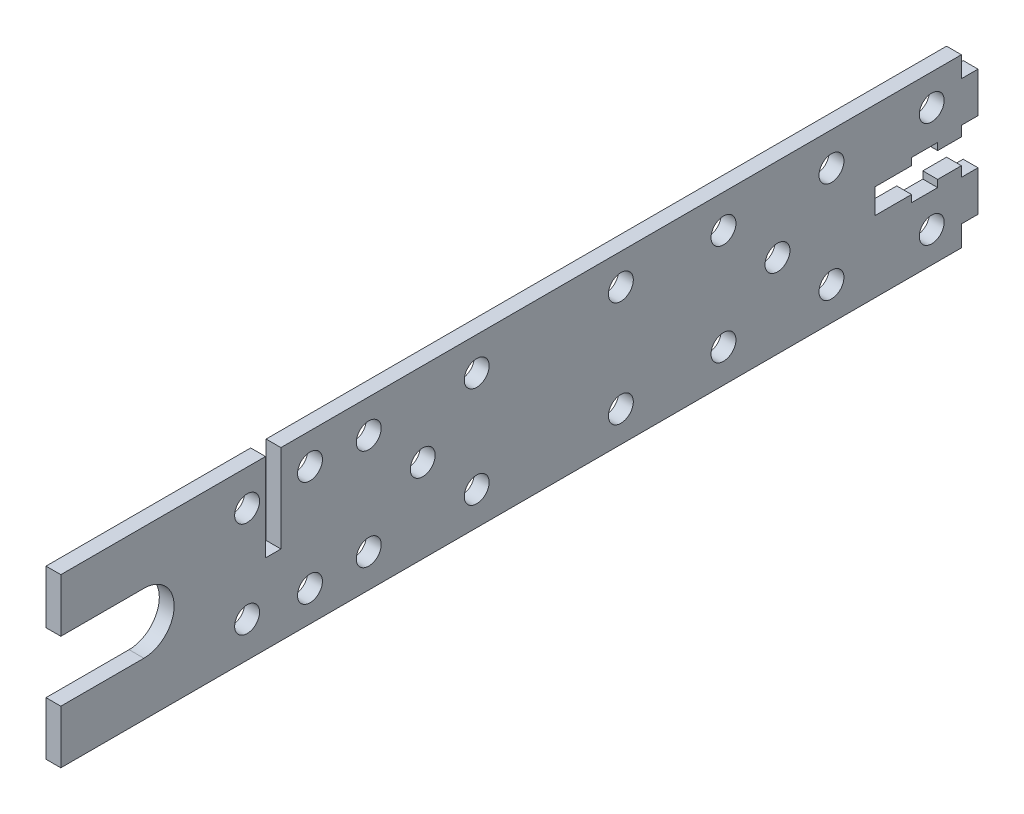
from build123d import *

# Parameters (mm, degrees)
SKETCH1_R           = 2.667
BOSS_EXTRUDE1_DEPTH = 1.5875
SKETCH2_W           = 3.302
SKETCH2_H           = 18.796
CUT_EXTRUDE1_DEPTH  = 100.841306657


with BuildPart() as part:
    # Sketch1 → Boss-Extrude1 (new, symmetric)
    with BuildSketch(Plane(origin=(0, 0, 0), x_dir=(0, 0, -1), z_dir=(1, 0, 0))):
        with BuildLine():
            Line((94.615, 17.907), (-98.171, 17.907))
            Line((-98.171, 17.907), (-98.171, 6.477))
            Line((-98.171, 6.477), (-80.391, 6.477))
            ThreePointArc((-80.391, 6.477), (-73.914, 0), (-80.391, -6.477))
            Line((-80.391, -6.477), (-98.171, -6.477))
            Line((-98.171, -6.477), (-98.171, -17.907))
            Line((-98.171, -17.907), (94.615, -17.907))
            Line((94.615, -17.907), (94.615, -13.462))
            Line((94.615, -13.462), (98.171, -13.462))
            Line((98.171, -13.462), (98.171, -4.826))
            Line((98.171, -4.826), (94.615, -4.826))
            Line((94.615, -4.826), (94.615, -2.667))
            Line((94.615, -2.667), (89.535, -2.667))
            Line((89.535, -2.667), (89.535, -4.191))
            Line((89.535, -4.191), (83.947, -4.191))
            Line((83.947, -4.191), (83.947, -2.667))
            Line((83.947, -2.667), (76.073, -2.667))
            Line((76.073, -2.667), (76.073, 2.667))
            Line((76.073, 2.667), (83.947, 2.667))
            Line((83.947, 2.667), (83.947, 4.191))
            Line((83.947, 4.191), (89.535, 4.191))
            Line((89.535, 4.191), (89.535, 2.667))
            Line((89.535, 2.667), (94.615, 2.667))
            Line((94.615, 2.667), (94.615, 4.826))
            Line((94.615, 4.826), (98.171, 4.826))
            Line((98.171, 4.826), (98.171, 13.462))
            Line((98.171, 13.462), (94.615, 13.462))
            Line((94.615, 13.462), (94.615, 17.907))
        make_face()
        with Locations((-58.293, -10.287)):
            Circle(SKETCH1_R, mode=Mode.SUBTRACT)
        with Locations((-44.831, -11.303)):
            Circle(SKETCH1_R, mode=Mode.SUBTRACT)
        with Locations((-32.258, -10.795)):
            Circle(SKETCH1_R, mode=Mode.SUBTRACT)
        with Locations((-9.144, -10.795)):
            Circle(SKETCH1_R, mode=Mode.SUBTRACT)
        with Locations((-20.701, 0)):
            Circle(SKETCH1_R, mode=Mode.SUBTRACT)
        with Locations((21.717, -11.303)):
            Circle(SKETCH1_R, mode=Mode.SUBTRACT)
        with Locations((43.688, -10.795)):
            Circle(SKETCH1_R, mode=Mode.SUBTRACT)
        with Locations((66.802, -10.795)):
            Circle(SKETCH1_R, mode=Mode.SUBTRACT)
        with Locations((88.265, -11.303)):
            Circle(SKETCH1_R, mode=Mode.SUBTRACT)
        with Locations((55.245, 0)):
            Circle(SKETCH1_R, mode=Mode.SUBTRACT)
        with Locations((-58.293, 10.287)):
            Circle(SKETCH1_R, mode=Mode.SUBTRACT)
        with Locations((-32.258, 10.795)):
            Circle(SKETCH1_R, mode=Mode.SUBTRACT)
        with Locations((-44.831, 11.303)):
            Circle(SKETCH1_R, mode=Mode.SUBTRACT)
        with Locations((-9.144, 10.795)):
            Circle(SKETCH1_R, mode=Mode.SUBTRACT)
        with Locations((21.717, 11.303)):
            Circle(SKETCH1_R, mode=Mode.SUBTRACT)
        with Locations((43.688, 10.795)):
            Circle(SKETCH1_R, mode=Mode.SUBTRACT)
        with Locations((66.802, 10.795)):
            Circle(SKETCH1_R, mode=Mode.SUBTRACT)
        with Locations((88.265, 11.303)):
            Circle(SKETCH1_R, mode=Mode.SUBTRACT)
    extrude(amount=BOSS_EXTRUDE1_DEPTH, both=True)

    # Sketch2 → Cut-Extrude1 (cut, through all)
    with BuildSketch(Plane(origin=(1.5875, 0, 0), x_dir=(0, 0, -1), z_dir=(1, 0, 0))):
        with Locations((-52.705, 8.509)):
            Rectangle(SKETCH2_W, SKETCH2_H)
    extrude(amount=-CUT_EXTRUDE1_DEPTH, mode=Mode.SUBTRACT)


solid = part.part
